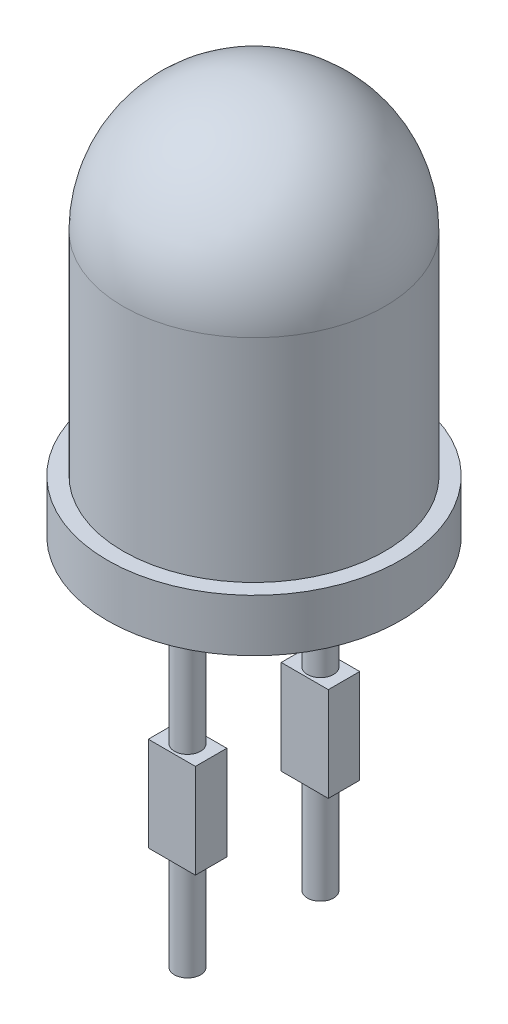
from build123d import *

# Parameters (mm, degrees)
SKETCH2_R               = 0.25
BOSS_EXTRUDE1_DEPTH     = 11
BOSS_EXTRUDE1_2_DEPTH   = 11
SKETCH3_W               = 0.6
SKETCH3_H               = 1.8
BOSS_EXTRUDE2_DEPTH     = 0.45
CUT_EXTRUDE1_DEPTH      = 15.573284633
CUT_EXTRUDE1_DEPTH_BACK = 15.573284633
SKETCH4_W               = 8.329743434
SKETCH4_H               = 6.44613311


with BuildPart() as part:
    # Sketch1 → Revolve1 (revolve)
    with BuildSketch(Plane(origin=(0, 0, 0), x_dir=(0, 0, -1), z_dir=(1, 0, 0))):
        with BuildLine():
            Line((-2.5, 2.025), (-2.5, -2.025))
            Line((-2.5, -2.025), (-2.8, -2.025))
            Line((-2.8, -2.025), (-2.8, -3.025))
            Line((-2.8, -3.025), (0, -3.025))
            Line((0, -3.025), (0, 4.525))
            ThreePointArc((0, 4.525), (-1.767766953, 3.792766953), (-2.5, 2.025))
        make_face()
    revolve(axis=Axis((0, 4.525, 0), (0, -1, 0)))


with BuildPart() as body_2:
    # Sketch2 → Boss-Extrude1 (new body)
    with BuildSketch(Plane.XZ.offset(3.025)):
        with Locations((0, 1.27)):
            Circle(SKETCH2_R)
    extrude(amount=BOSS_EXTRUDE1_DEPTH)



with BuildPart() as body_3:
    # Sketch2 → Boss-Extrude1 2 (new body)
    with BuildSketch(Plane.XZ.offset(3.025)):
        with Locations((0, -1.27)):
            Circle(SKETCH2_R)
    extrude(amount=BOSS_EXTRUDE1_2_DEPTH)


with BuildPart() as body_2_1:
    add(body_2.part)

    add(body_3.part)  # Boss-Extrude2 merges body 3
    # Sketch3 → Boss-Extrude2 (add, symmetric)
    with BuildSketch(Plane(origin=(0, 0, 0), x_dir=(0, 0, -1), z_dir=(1, 0, 0))):
        with Locations((1.27, -6.725)):
            Rectangle(SKETCH3_W, SKETCH3_H)
        with Locations((-1.27, -6.725)):
            Rectangle(SKETCH3_W, SKETCH3_H)
    extrude(amount=BOSS_EXTRUDE2_DEPTH, both=True)

    # Sketch4 → Cut-Extrude1 (cut, two sides: drawn at the far end of the back side and taken through both)
    with BuildSketch(Plane(origin=(0, 0, 0), x_dir=(0, 0, -1), z_dir=(1, 0, 0)).offset(-CUT_EXTRUDE1_DEPTH_BACK)):
        with Locations((-0.219754538, -12.748066555)):
            Rectangle(SKETCH4_W, SKETCH4_H)
    extrude(amount=CUT_EXTRUDE1_DEPTH + CUT_EXTRUDE1_DEPTH_BACK, mode=Mode.SUBTRACT)


solid = Compound([part.part, body_2_1.part])
